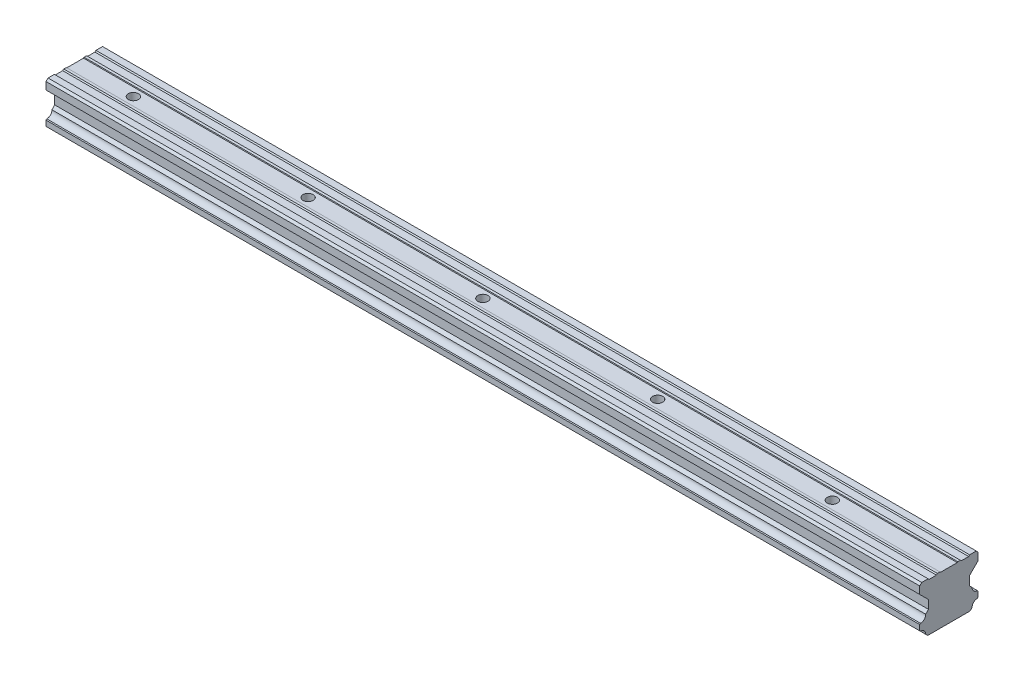
from build123d import *

# Parameters (mm, degrees)
BOSS_EXTRUDE1_DEPTH = 300
HOLE1_D             = 3.5
HOLE1_CBORE_D       = 6
HOLE1_CBORE_DEPTH   = 8.5
LPATTERN1_COUNT     = 5
LPATTERN1_PITCH     = 60


with BuildPart() as part:
    # Sketch1 → Boss-Extrude1 (new body)
    with BuildSketch(Plane(origin=(0, 0, 0), x_dir=(0, 0, -1), z_dir=(1, 0, 0))):
        with BuildLine():
            Line((-7.965754986, -7.693975449), (-7.266272068, -8.393458366))
            Line((-7.266272068, -8.393458366), (7.266272068, -8.393458366))
            Line((7.266272068, -8.393458366), (7.965754986, -7.693975449))
            ThreePointArc((7.965754986, -7.693975449), (8.474723757, -6.421557866), (9.747437917, -5.913331162))
            Line((9.747437917, -5.913331162), (10.000000437, -5.660768637))
            Line((10.000000437, -5.660768637), (10.000000437, -3.788406023))
            Line((10.000000437, -3.788406023), (9.747437912, -3.535843503))
            ThreePointArc((9.747437912, -3.535843503), (8.462742055, -3.016656911), (7.965755402, -1.72321096))
            Line((7.965755402, -1.72321096), (7.005148341, -0.762603918))
            Line((7.005148341, -0.762603918), (7.005148341, 2.166206023))
            Line((7.005148341, 2.166206023), (10.000000347, 5.161058089))
            Line((10.000000347, 5.161058089), (10.000000347, 7.712387211))
            Line((10.000000347, 7.712387211), (9.408464779, 8.393458268))
            Line((9.408464779, 8.393458268), (7.133016457, 8.393458268))
            Line((7.133016457, 8.393458268), (6.789534443, 8.049976247))
            Line((6.789534443, 8.049976247), (4.271139656, 8.049976247))
            Line((4.271139656, 8.049976247), (3.927707784, 8.393458265))
            Line((3.927707784, 8.393458265), (3.061282509, 8.393458265))
            Line((3.061282509, 8.393458265), (2.872049327, 8.204225079))
            Line((2.872049327, 8.204225079), (-2.87204886, 8.204225079))
            Line((-2.87204886, 8.204225079), (-3.061282046, 8.393458261))
            Line((-3.061282046, 8.393458261), (-3.927707321, 8.393458261))
            Line((-3.927707321, 8.393458261), (-4.271189216, 8.049976359))
            Line((-4.271189216, 8.049976359), (-6.789534095, 8.049976359))
            Line((-6.789534095, 8.049976359), (-7.133016116, 8.393458373))
            Line((-7.133016116, 8.393458373), (-9.30771733, 8.393458373))
            Line((-9.30771733, 8.393458373), (-10, 7.70117569))
            Line((-10, 7.70117569), (-10, 5.161058187))
            Line((-10, 5.161058187), (-7.005147934, 2.166206181))
            Line((-7.005147934, 2.166206181), (-7.005147934, -0.76260376))
            Line((-7.005147934, -0.76260376), (-7.965754986, -1.723210812))
            ThreePointArc((-7.965754986, -1.723210812), (-8.462741848, -3.016656549), (-9.747437477, -3.535843372))
            Line((-9.747437477, -3.535843372), (-10, -3.788405895))
            Line((-10, -3.788405895), (-10, -5.660768509))
            Line((-10, -5.660768509), (-9.747437477, -5.913331032))
            ThreePointArc((-9.747437477, -5.913331032), (-8.474723558, -6.421557943), (-7.965754986, -7.693975449))
        make_face()
    extrude(amount=BOSS_EXTRUDE1_DEPTH)

    # Hole1 (through all)
    with Locations(Plane(origin=(20, -8.393458366, 0), x_dir=(0, 0, -1), z_dir=(0, -1, 0))):
        with Locations((0, 0)):
            hole1 = CounterBoreHole(HOLE1_D / 2, HOLE1_CBORE_D / 2, HOLE1_CBORE_DEPTH)

    # LPattern1: Hole1 ×5
    with Locations(*[(i * LPATTERN1_PITCH, 0, 0) for i in range(1, LPATTERN1_COUNT)]):
        add(hole1, mode=Mode.SUBTRACT)


solid = part.part
